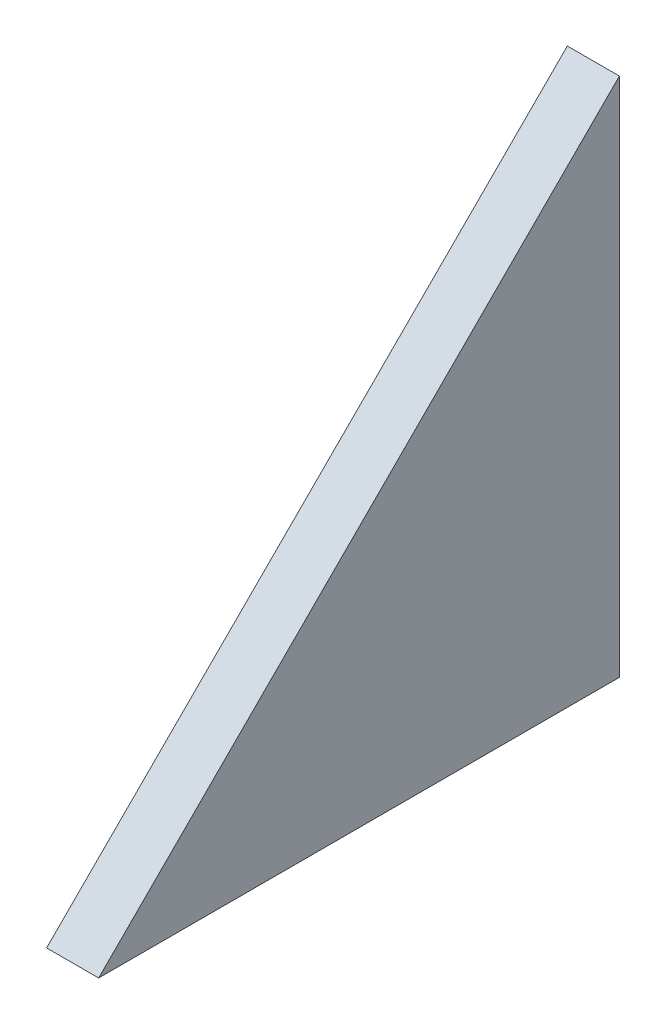
from build123d import *

# Parameters (mm, degrees)
BOSS_EXTRUDE2_DEPTH = 3


with BuildPart() as part:
    # Sketch2 → Boss-Extrude2 (new body)
    with BuildSketch(Plane(origin=(-5.957962043, 0, 0), x_dir=(0, 0, -1), z_dir=(1, 0, 0))):
        Polygon((-7.302957559, -51.905150875), (-7.302957559, -21.905150875), (-37.302957559, -51.905150875), align=None)
    extrude(amount=-BOSS_EXTRUDE2_DEPTH)


solid = part.part
